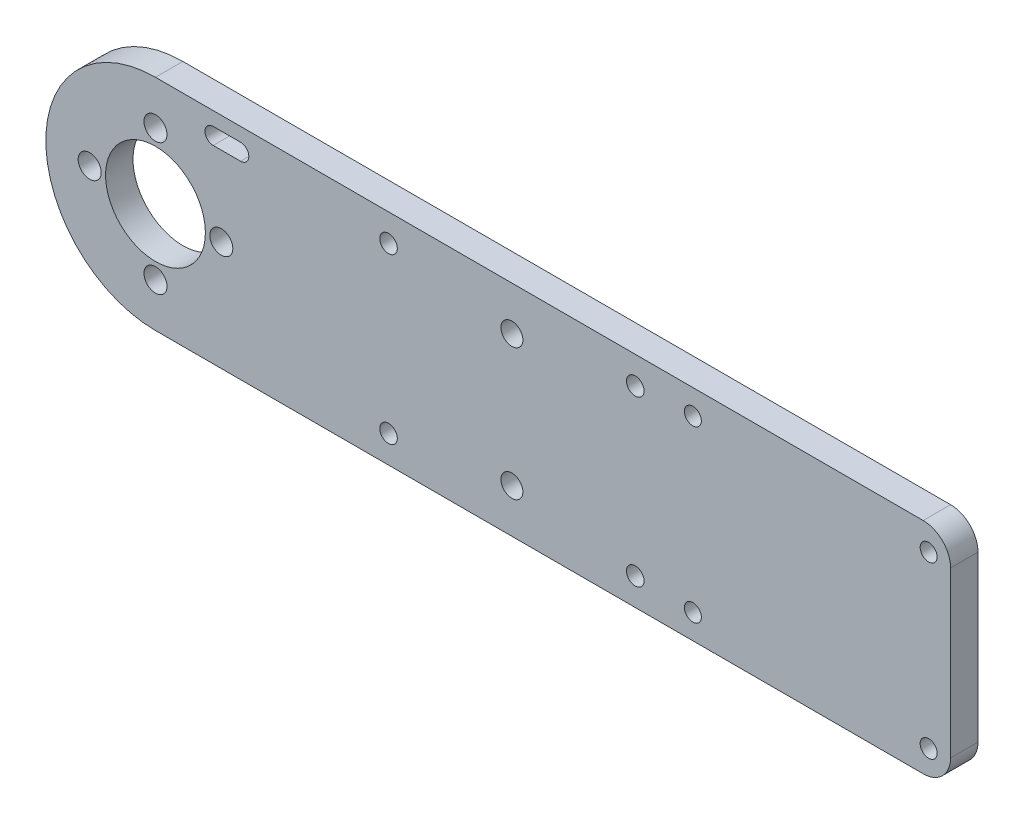
from build123d import *

# Parameters (mm, degrees)
SKETCH2_R           = 9.1
BOSS_EXTRUDE1_DEPTH = 2.5
FILLET1_R           = 5
SKETCH3_R           = 2.1
CUT_EXTRUDE1_DEPTH  = 147.458185159
SKETCH3_4_R         = 1.55
SKETCH3_4_R_2       = 1.6
SKETCH3_4_R_3       = 2
CUT_EXTRUDE2_DEPTH  = 10
SKETCH4_R           = 2.5
CUT_EXTRUDE3_DEPTH  = 2


with BuildPart() as part:
    # Sketch2 → Boss-Extrude1 (new, symmetric)
    with BuildSketch(Plane.XY):
        with BuildLine():
            Line((145, 20), (0, 20))
            ThreePointArc((0, 20), (-20, 0), (0, -20))
            Line((0, -20), (145, -20))
            Line((145, -20), (145, 20))
        make_face()
        Circle(SKETCH2_R, mode=Mode.SUBTRACT)
    extrude(amount=BOSS_EXTRUDE1_DEPTH, both=True)

    # Fillet1
    fillet1_edges = [part.edges().sort_by_distance(p)[0] for p in [
        (145, -20, 0),
        (145, 20, 0),
    ]]
    fillet(fillet1_edges, radius=FILLET1_R)

    # Sketch3 → Cut-Extrude1 (cut, through all)
    with BuildSketch(Plane(origin=(0, 0, -2.5), x_dir=(-1, 0, 0), z_dir=(0, 0, -1))):
        with Locations((-12, 0)):
            Circle(SKETCH3_R)
        with Locations((0, 12)):
            Circle(SKETCH3_R)
        with Locations((0, -12)):
            Circle(SKETCH3_R)
        with Locations((12, 0)):
            Circle(SKETCH3_R)
    extrude(amount=-CUT_EXTRUDE1_DEPTH, mode=Mode.SUBTRACT)

    # Sketch3<4> → Cut-Extrude2 (cut)
    with BuildSketch(Plane(origin=(0, 0, -2.5), x_dir=(-1, 0, 0), z_dir=(0, 0, -1))):
        with Locations((-98, 15.5)):
            Circle(SKETCH3_4_R)
        with Locations((-87.5, 15)):
            Circle(SKETCH3_4_R_2)
        with Locations((-65, 12)):
            Circle(SKETCH3_4_R_3)
        with BuildLine():
            Line((-10.518524874, 17.5), (-15.518524874, 17.5))
            ThreePointArc((-15.518524874, 17.5), (-17.018524874, 16), (-15.518524874, 14.5))
            Line((-15.518524874, 14.5), (-10.518524874, 14.5))
            ThreePointArc((-10.518524874, 14.5), (-9.018524874, 16), (-10.518524874, 17.5))
        make_face()
        with Locations((-98, -15.5)):
            Circle(SKETCH3_4_R)
        with Locations((-141, -15.5)):
            Circle(SKETCH3_4_R)
        with Locations((-141, 15.5)):
            Circle(SKETCH3_4_R)
        with Locations((-87.5, -15)):
            Circle(SKETCH3_4_R_2)
        with Locations((-42.5, -15)):
            Circle(SKETCH3_4_R_2)
        with Locations((-42.5, 15)):
            Circle(SKETCH3_4_R_2)
        with Locations((-65, -12)):
            Circle(SKETCH3_4_R_3)
    extrude(amount=-CUT_EXTRUDE2_DEPTH, mode=Mode.SUBTRACT)

    # Sketch4 → Cut-Extrude3 (cut)
    with BuildSketch(Plane(origin=(0, 0, -2.5), x_dir=(-1, 0, 0), z_dir=(0, 0, -1))):
        with Locations((-42.5, 15)):
            Circle(SKETCH4_R)
        with Locations((-42.5, -15)):
            Circle(SKETCH4_R)
    extrude(amount=-CUT_EXTRUDE3_DEPTH, mode=Mode.SUBTRACT)


solid = part.part
